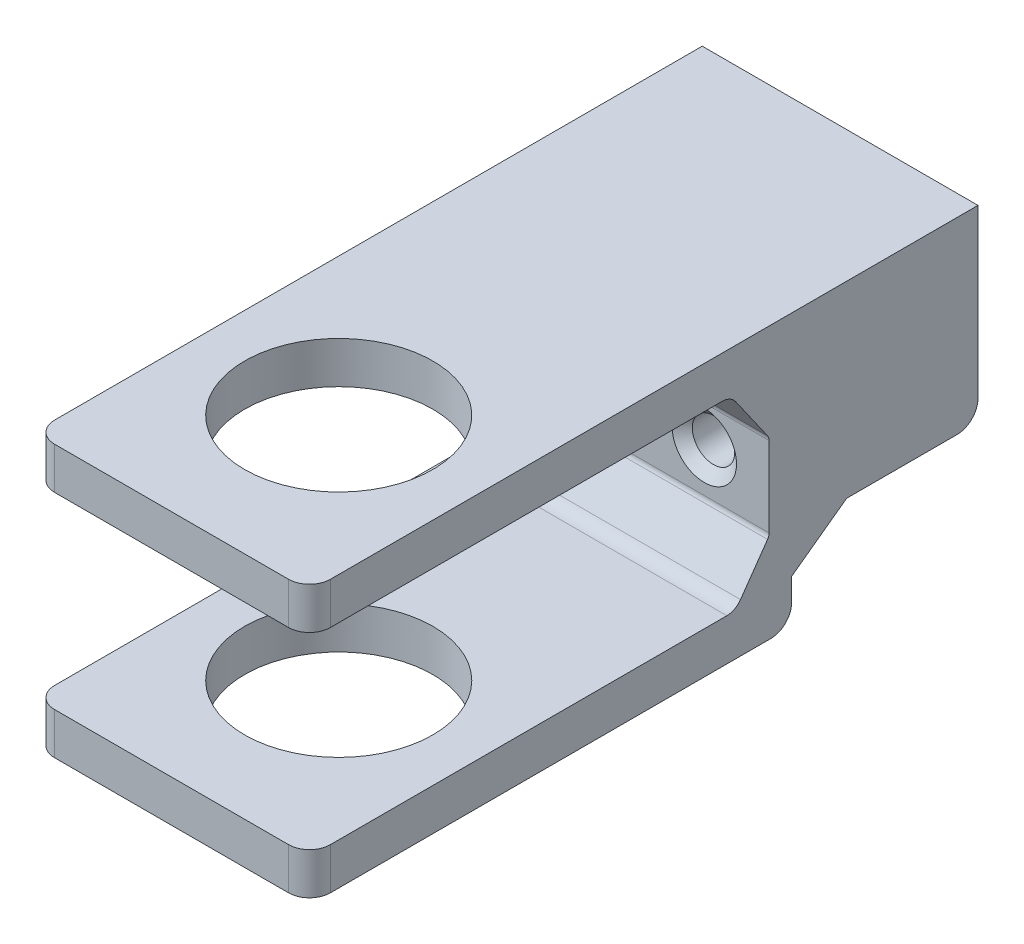
from build123d import *

# Parameters (mm, degrees)
SKETCH1_W                                          = 41.91
SKETCH1_H                                          = 101.6
BOSS_EXTRUDE1_DEPTH                                = 41.275
CUT_EXTRUDE6_DEPTH                                 = 78.72202857
SKETCH3_R                                          = 14.3002
CUT_EXTRUDE2_DEPTH                                 = 69.726833551
CUT_EXTRUDE7_DEPTH                                 = 78.72202857
SKETCH4_R                                          = 3.2258
CUT_EXTRUDE3_DEPTH                                 = 112.648097386
FILLET2_R                                          = 3.175
CSK_FOR_10_FLAT_HEAD_MACHINE_SCREW_100_D           = 5.6134
CSK_FOR_10_FLAT_HEAD_MACHINE_SCREW_100_DEPTH       = 31.75
CSK_FOR_10_FLAT_HEAD_MACHINE_SCREW_100_CSINK_D     = 9.779
CSK_FOR_10_FLAT_HEAD_MACHINE_SCREW_100_CSINK_ANGLE = 100
CSK_FOR_10_FLAT_HEAD_MACHINE_SCREW_100_TIP         = 1.686435499
FILLET3_R                                          = 2.54
FILLET4_R                                          = 1.27


with BuildPart() as part:
    # Sketch1 → Boss-Extrude1 (new body)
    with BuildSketch(Plane(origin=(0, 0, 0), x_dir=(1, 0, 0), z_dir=(0, 1, 0))):
        Rectangle(SKETCH1_W, SKETCH1_H)
    extrude(amount=BOSS_EXTRUDE1_DEPTH)

    # Sketch13 → Cut-Extrude6 (cut, through all)
    with BuildSketch(Plane.ZY.offset(20.955)):
        Polygon((-13.222463407, 34.925), (-19.05, 26.60241523), (-19.05, 13.632261674), (-13.950905481, 6.35), (50.8, 6.35), (50.8, 34.925), align=None)
    extrude(amount=-CUT_EXTRUDE6_DEPTH, mode=Mode.SUBTRACT)

    # Sketch3 → Cut-Extrude2 (cut, through all)
    with BuildSketch(Plane(origin=(0, 41.275, 0), x_dir=(1, 0, 0), z_dir=(0, 1, 0))):
        with Locations((0, -25.4)):
            Circle(SKETCH3_R)
    extrude(amount=-CUT_EXTRUDE2_DEPTH, mode=Mode.SUBTRACT)

    # Sketch17 → Cut-Extrude7 (cut, through all)
    with BuildSketch(Plane.ZY.offset(20.955)):
        Polygon((-30.835896066, 12.7), (-22.479, 6.60844974), (-22.479, 0), (-50.8, 0), (-50.8, 12.7), align=None)
    extrude(amount=-CUT_EXTRUDE7_DEPTH, mode=Mode.SUBTRACT)

    # Sketch4 → Cut-Extrude3 (cut, through all)
    with BuildSketch(Plane(origin=(0, 0, -50.8), x_dir=(-1, 0, 0), z_dir=(0, 0, -1))):
        with Locations((11.1125, 20.6375)):
            Circle(SKETCH4_R)
        with Locations((-11.1125, 20.6375)):
            Circle(SKETCH4_R)
    extrude(amount=-CUT_EXTRUDE3_DEPTH, mode=Mode.SUBTRACT)

    # Fillet2
    fillet2_edges = [part.edges().sort_by_distance(p)[0] for p in [
        (-20.955, 3.175, 50.8),
        (20.955, 3.175, 50.8),
        (-20.955, 38.1, 50.8),
        (20.955, 38.1, 50.8),
        (0, 12.7, -50.8),
        (0, 0, -22.479),
    ]]
    fillet(fillet2_edges, radius=FILLET2_R)

    # CSK for #10 Flat Head Machine Screw (100)4
    with Locations(Plane.XY.offset(-19.05)):
        with Locations((-11.1125, 20.6375), (11.1125, 20.6375)):
            CounterSinkHole(CSK_FOR_10_FLAT_HEAD_MACHINE_SCREW_100_D / 2, CSK_FOR_10_FLAT_HEAD_MACHINE_SCREW_100_CSINK_D / 2, depth=CSK_FOR_10_FLAT_HEAD_MACHINE_SCREW_100_DEPTH, counter_sink_angle=CSK_FOR_10_FLAT_HEAD_MACHINE_SCREW_100_CSINK_ANGLE)
            with Locations((0, 0, -(CSK_FOR_10_FLAT_HEAD_MACHINE_SCREW_100_DEPTH + CSK_FOR_10_FLAT_HEAD_MACHINE_SCREW_100_TIP / 2))):  # 118° drill point
                Cone(0, CSK_FOR_10_FLAT_HEAD_MACHINE_SCREW_100_D / 2, CSK_FOR_10_FLAT_HEAD_MACHINE_SCREW_100_TIP, mode=Mode.SUBTRACT)

    # Fillet3
    fillet3_edges = [part.edges().sort_by_distance(p)[0] for p in [
        (0, 6.35, -13.950905481),
        (0, 34.925, -13.222463407),
    ]]
    fillet(fillet3_edges, radius=FILLET3_R)

    # Fillet4
    fillet4_edges = [part.edges().sort_by_distance(p)[0] for p in [
        (0, 13.632261674, -19.05),
        (0, 26.60241523, -19.05),
    ]]
    fillet(fillet4_edges, radius=FILLET4_R)


solid = part.part
